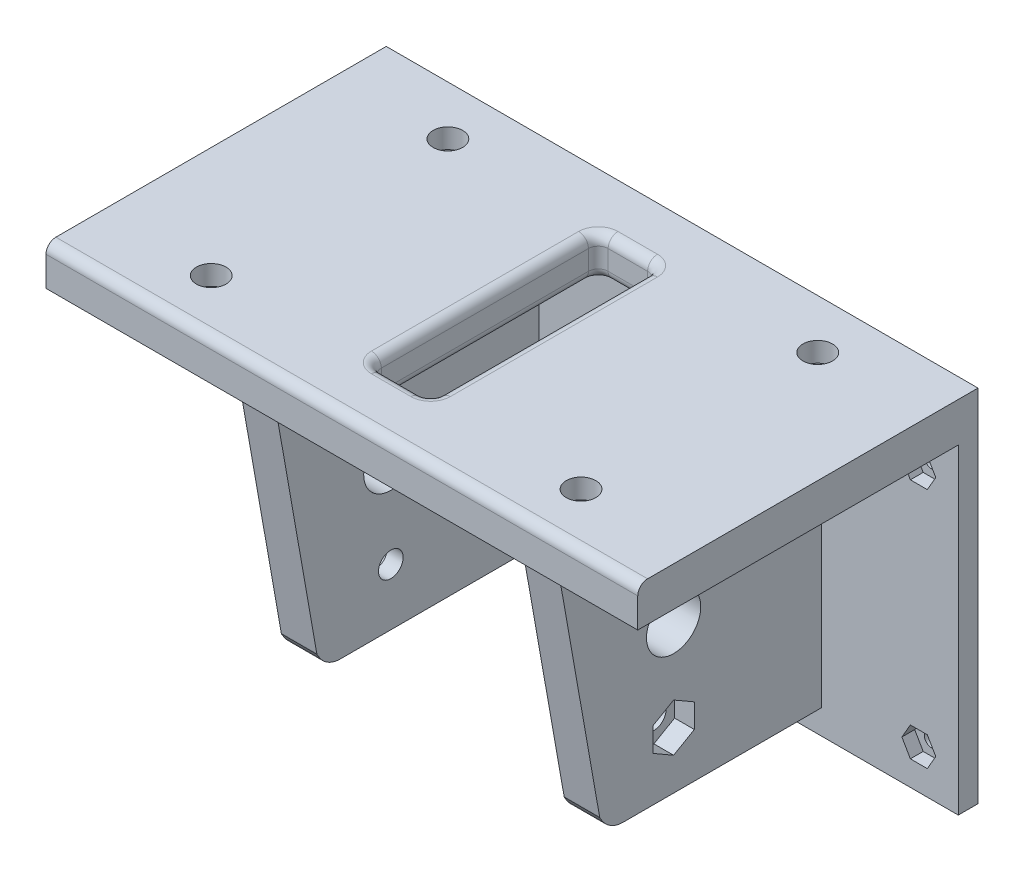
from build123d import *
from OCP.BRepFilletAPI import BRepFilletAPI_MakeChamfer

# Parameters (mm, degrees)
SKETCH1_W               = 120
SKETCH1_H               = 70
SKETCH1_R               = 3
SKETCH1_W_2             = 12
SKETCH1_H_2             = 46
BOSS_EXTRUDE1_DEPTH     = 8
FILLET1_R               = 2
SKETCH2_W               = 120
SKETCH2_H               = 5
BOSS_EXTRUDE2_DEPTH     = 65
SKETCH3_W               = 7.2
SKETCH3_H               = 60
BOSS_EXTRUDE3_DEPTH     = 45
CUT_EXTRUDE1_DEPTH      = 119.172228654
CUT_EXTRUDE1_DEPTH_BACK = 119.172228654
SKETCH4_R               = 5.5
SKETCH4_R_2             = 2.5
CUT_EXTRUDE2_DEPTH      = 4
CUT_EXTRUDE3_DEPTH      = 4
CUT_EXTRUDE4_DEPTH      = 4
CHAMFER1_SIZE           = 10
CHAMFER1_SIZE2          = 56.712818196
FILLET3_R               = 2
CHAMFER2_SIZE           = 2
CHAMFER2_SIZE2          = 3.200669058
FILLET4_R               = 5
CHAMFER3_SIZE           = 1
SKETCH11_R              = 1.5
CUT_EXTRUDE7_DEPTH      = 10
CUT_EXTRUDE8_DEPTH      = 2.6


with BuildPart() as part:
    # Sketch1 → Boss-Extrude1 (new body)
    with BuildSketch(Plane(origin=(0, 0, 0), x_dir=(1, 0, 0), z_dir=(0, 1, 0))):
        Rectangle(SKETCH1_W, SKETCH1_H)
        with Locations((-37.5, 24)):
            Circle(SKETCH1_R, mode=Mode.SUBTRACT)
        with Locations((-37.5, -24)):
            Circle(SKETCH1_R, mode=Mode.SUBTRACT)
        with Locations((37.5, 24)):
            Circle(SKETCH1_R, mode=Mode.SUBTRACT)
        with Locations((37.5, -24)):
            Circle(SKETCH1_R, mode=Mode.SUBTRACT)
        Rectangle(SKETCH1_W_2, SKETCH1_H_2, mode=Mode.SUBTRACT)
    extrude(amount=BOSS_EXTRUDE1_DEPTH)

    # Fillet1
    fillet1_edges = [part.edges().sort_by_distance(p)[0] for p in [
        (6, 4, 23),
        (-6, 4, 23),
        (6, 4, -23),
        (-6, 4, -23),
    ]]
    fillet(fillet1_edges, radius=FILLET1_R)

    # Sketch2 → Boss-Extrude2 (add)
    with BuildSketch(Plane.XZ):
        with Locations((0, -32.5)):
            Rectangle(SKETCH2_W, SKETCH2_H)
    extrude(amount=BOSS_EXTRUDE2_DEPTH)

    # Sketch3 → Boss-Extrude3 (add)
    with BuildSketch(Plane.XY.offset(-30)):
        with Locations((-28.675, -30)):
            Rectangle(SKETCH3_W, SKETCH3_H)
        with Locations((28.675, -30)):
            Rectangle(SKETCH3_W, SKETCH3_H)
    extrude(amount=BOSS_EXTRUDE3_DEPTH)

    # Sketch4 → Cut-Extrude1 (cut, two sides: drawn at the far end of the back side and taken through both)
    with BuildSketch(Plane.ZY.offset(32.275).offset(-CUT_EXTRUDE1_DEPTH_BACK)):
        with Locations((0, -30)):
            Circle(SKETCH4_R)
        with Locations((0, -11.5)):
            Circle(SKETCH4_R_2)
        with Locations((0, -48.5)):
            Circle(SKETCH4_R_2)
    extrude(amount=CUT_EXTRUDE1_DEPTH + CUT_EXTRUDE1_DEPTH_BACK, mode=Mode.SUBTRACT)

    # Sketch5 → Cut-Extrude2 (cut)
    with BuildSketch(Plane.ZY.offset(32.275)):
        Polygon((4.2, -9.075128869), (0, -6.650257739), (-4.2, -9.075128869), (-4.2, -13.924871131), (0, -16.349742261), (4.2, -13.924871131), align=None)
        Polygon((4.2, -46.075128869), (0, -43.650257739), (-4.2, -46.075128869), (-4.2, -50.924871131), (0, -53.349742261), (4.2, -50.924871131), align=None)
    extrude(amount=-CUT_EXTRUDE2_DEPTH, mode=Mode.SUBTRACT)

    # Sketch6 → Cut-Extrude3 (cut)
    with BuildSketch(Plane(origin=(32.275, 0, 0), x_dir=(0, 0, -1), z_dir=(1, 0, 0))):
        Polygon((4.2, -13.924871131), (4.2, -9.075128869), (0, -6.650257739), (-4.2, -9.075128869), (-4.2, -13.924871131), (0, -16.349742261), align=None)
        Polygon((-4.2, -46.075128869), (-4.2, -50.924871131), (0, -53.349742261), (4.2, -50.924871131), (4.2, -46.075128869), (0, -43.650257739), align=None)
    extrude(amount=-CUT_EXTRUDE3_DEPTH, mode=Mode.SUBTRACT)

    # Sketch7 → Cut-Extrude4 (cut)
    with BuildSketch(Plane.XZ):
        Polygon((42.7, -20.9977786), (37.5, -17.9955572), (32.3, -20.9977786), (32.3, -27.0022214), (37.5, -30.0044428), (42.7, -27.0022214), align=None)
        Polygon((42.7, 27.0022214), (37.5, 30.0044428), (32.3, 27.0022214), (32.3, 20.9977786), (37.5, 17.9955572), (42.7, 20.9977786), align=None)
        Polygon((-42.7, -27.0022214), (-42.7, -20.9977786), (-37.5, -17.9955572), (-32.3, -20.9977786), (-32.3, -27.0022214), (-37.5, -30.0044428), align=None)
        Polygon((-42.7, 20.9977786), (-42.7, 27.0022214), (-37.5, 30.0044428), (-32.3, 27.0022214), (-32.3, 20.9977786), (-37.5, 17.9955572), align=None)
    extrude(amount=-CUT_EXTRUDE4_DEPTH, mode=Mode.SUBTRACT)

    # Chamfer1
    chamfer1_edges = [part.edges().sort_by_distance(p)[0] for p in [
        (-28.675, 0, 15),
        (28.675, 0, 15),
    ]]
    chamfer1_side = [part.faces().sort_by_distance(p)[0] for p in [
        (-58.635265594, 0, 2.5),
    ]]
    chamfer(chamfer1_edges, length=CHAMFER1_SIZE, length2=CHAMFER1_SIZE2, reference=chamfer1_side[0])

    # Fillet3
    fillet3_edges = [part.edges().sort_by_distance(p)[0] for p in [
        (5.414213562, 0, 22.414213562),
        (0, 0, 23),
        (-5.414213562, 0, 22.414213562),
        (-6, 0, 0),
        (-5.414213562, 0, -22.414213562),
        (0, 0, -23),
        (5.414213562, 0, -22.414213562),
        (5.414213562, 8, 22.414213562),
        (0, 8, 23),
        (-5.414213562, 8, 22.414213562),
        (-6, 8, 0),
        (-5.414213562, 8, -22.414213562),
        (0, 8, -23),
        (5.414213562, 8, -22.414213562),
        (6, 0, 0),
        (6, 8, 0),
        (0, 8, 35),
    ]]
    fillet(fillet3_edges, radius=FILLET3_R)

    # Chamfer2: one chamfer whose edges measure the first distance from different faces: ONE call of the kernel's chamfer builder (chamfer() names one face for all edges)
    chamfer2_edges_1 = [part.edges().sort_by_distance(p)[0] for p in [
        (28.675, -60, 15),
    ]]
    chamfer2_side_1 = [part.faces().sort_by_distance(p)[0] for p in [
        (28.675, -60, -7.5),
    ]]
    chamfer2_edges_2 = [part.edges().sort_by_distance(p)[0] for p in [
        (-28.675, -60, 15),
    ]]
    chamfer2_side_2 = [part.faces().sort_by_distance(p)[0] for p in [
        (-28.675, -60, -7.5),
    ]]
    chamfer2 = BRepFilletAPI_MakeChamfer(part.part.solid().wrapped)
    for e in chamfer2_edges_1:
        chamfer2.Add(CHAMFER2_SIZE, CHAMFER2_SIZE2, e.wrapped, chamfer2_side_1[0].wrapped)  # the first distance lies on this face
    for e in chamfer2_edges_2:
        chamfer2.Add(CHAMFER2_SIZE, CHAMFER2_SIZE2, e.wrapped, chamfer2_side_2[0].wrapped)  # the first distance lies on this face
    add(Compound.cast(chamfer2.Shape()), mode=Mode.REPLACE)

    # Fillet4
    fillet4_edges = [part.edges().sort_by_distance(p)[0] for p in [
        (-28.675, -60, 13),
        (28.675, -60, 13),
    ]]
    fillet(fillet4_edges, radius=FILLET4_R)

    # Chamfer3
    chamfer3_edges = [part.edges().sort_by_distance(p)[0] for p in [
        (0, 8, -35),
        (-60, -28.5, -35),
        (0, -65, -35),
        (60, -28.5, -35),
    ]]
    chamfer(chamfer3_edges, length=CHAMFER3_SIZE)

    # Sketch11 → Cut-Extrude7 (cut)
    with BuildSketch(Plane.XY.offset(-30)):
        with Locations((-52, -8)):
            Circle(SKETCH11_R)
        with Locations((-52, -57)):
            Circle(SKETCH11_R)
        with Locations((52, -8)):
            Circle(SKETCH11_R)
        with Locations((52, -57)):
            Circle(SKETCH11_R)
    extrude(amount=-CUT_EXTRUDE7_DEPTH, mode=Mode.SUBTRACT)

    # Sketch12 → Cut-Extrude8 (cut)
    with BuildSketch(Plane.XY.offset(-30)):
        Polygon((-48.564765898, -8), (-50.282382949, -5.025), (-53.717617051, -5.025), (-55.435234102, -8), (-53.717617051, -10.975), (-50.282382949, -10.975), align=None)
        Polygon((-48.564765898, -57), (-50.282382949, -54.025), (-53.717617051, -54.025), (-55.435234102, -57), (-53.717617051, -59.975), (-50.282382949, -59.975), align=None)
        Polygon((55.435234102, -57), (53.717617051, -54.025), (50.282382949, -54.025), (48.564765898, -57), (50.282382949, -59.975), (53.717617051, -59.975), align=None)
        Polygon((55.435234102, -8), (53.717617051, -5.025), (50.282382949, -5.025), (48.564765898, -8), (50.282382949, -10.975), (53.717617051, -10.975), align=None)
    extrude(amount=-CUT_EXTRUDE8_DEPTH, mode=Mode.SUBTRACT)


solid = part.part
